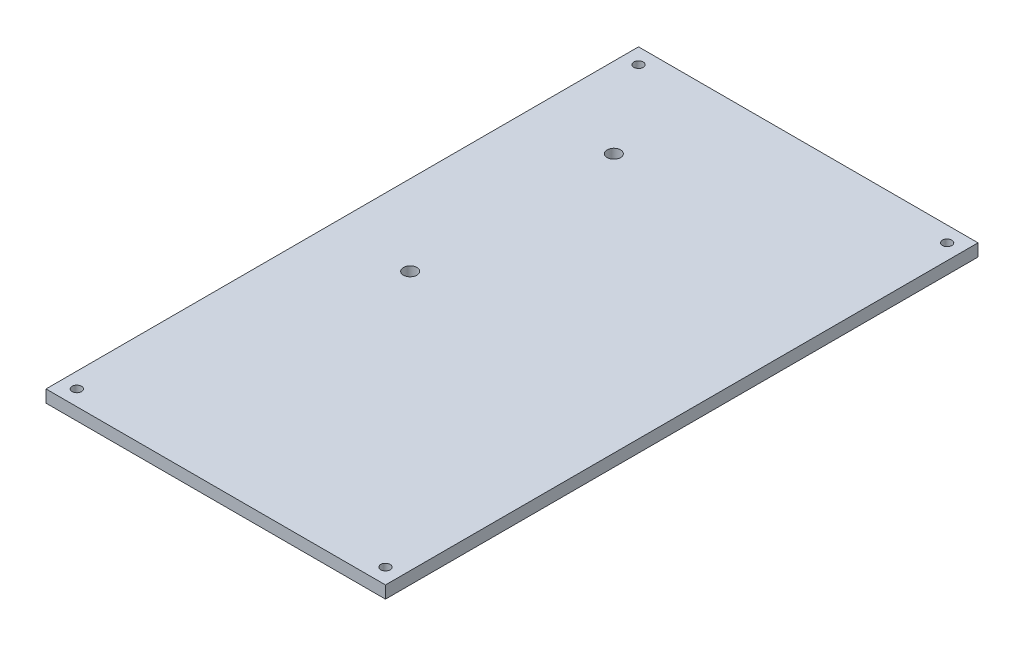
from build123d import *

# Parameters (mm, degrees)
SKETCH2_W                   = 55
SKETCH2_H                   = 96
BOSS_EXTRUDE1_DEPTH         = 2
SKETCH3_R                   = 0.762
CUT_EXTRUDE1_DEPTH          = 111.657128103
F_44_0_086_DIAMETER_HOLE2_D = 2.1844


with BuildPart() as part:
    # Sketch2 → Boss-Extrude1 (new body)
    with BuildSketch(Plane(origin=(0, 0, 0), x_dir=(1, 0, 0), z_dir=(0, 1, 0))):
        with Locations((27.5, 48)):
            Rectangle(SKETCH2_W, SKETCH2_H)
    extrude(amount=BOSS_EXTRUDE1_DEPTH)

    # Sketch3 → Cut-Extrude1 (cut, through all)
    with BuildSketch(Plane(origin=(0, 2, 0), x_dir=(1, 0, 0), z_dir=(0, 1, 0))):
        with Locations((2.5, 2.5)):
            Circle(SKETCH3_R)
        with Locations((52.5, 2.5)):
            Circle(SKETCH3_R)
        with Locations((52.5, 93.5)):
            Circle(SKETCH3_R)
        with Locations((2.5, 93.5)):
            Circle(SKETCH3_R)
    extrude(amount=-CUT_EXTRUDE1_DEPTH, mode=Mode.SUBTRACT)

    # #44 (0.086) Diameter Hole2 (through all)
    with Locations(Plane(origin=(0, 2, 0), x_dir=(1, 0, 0), z_dir=(0, 1, 0))):
        with Locations((13, 79), (13, 46)):
            Hole(F_44_0_086_DIAMETER_HOLE2_D / 2)


solid = part.part
